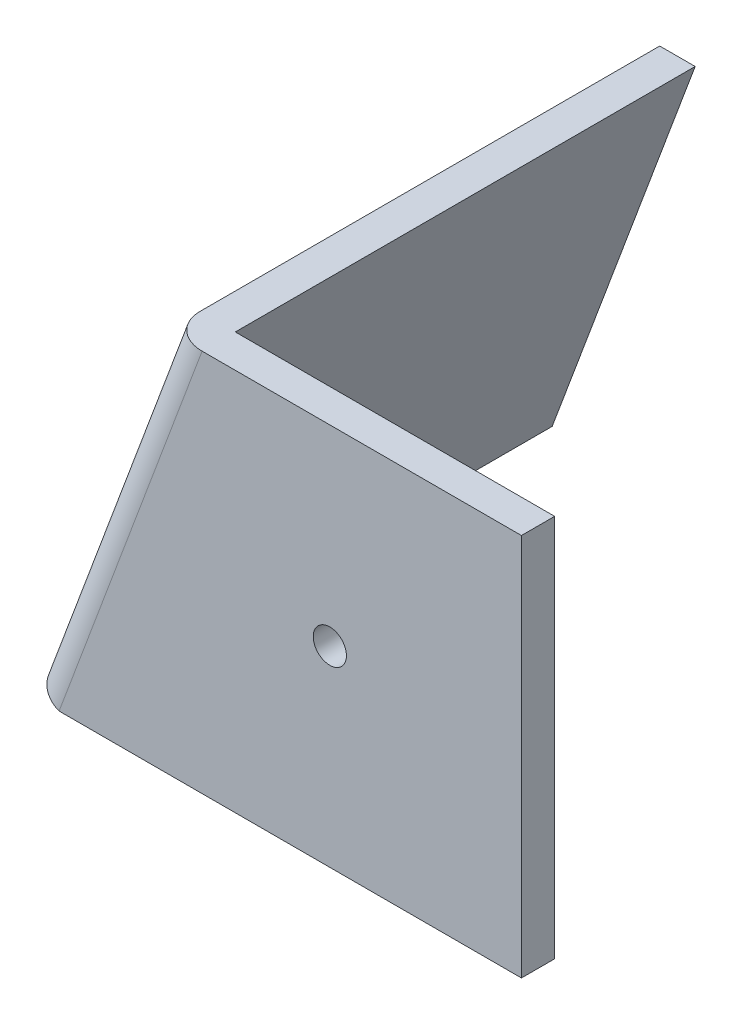
from build123d import *

# Parameters (mm, degrees)
SKETCH13_R              = 1.651
BASE_FLANGE5_DEPTH      = 3.302
EDGE_FLANGE4_START      = -51.763631849
EDGE_FLANGE4_DEPTH      = 40.665312179
CUT_EXTRUDE4_DEPTH      = 4.699
CUT_EXTRUDE4_DEPTH_BACK = 56.896


# Read off the part's stored shape, not the designer's step: Edge-Flange4
# Sheet-metal steps are written as plain solids
with BuildPart() as part:
    # Sketch13 → Base-Flange5 (new body)
    with BuildSketch(Plane.XY):
        Polygon((-31.75, 0), (0, 0), (0, -38.1), (-45.964697135, -38.1), align=None)
        with Locations((-19.05, -19.05)):
            Circle(SKETCH13_R, mode=Mode.SUBTRACT)
    extrude(amount=-BASE_FLANGE5_DEPTH)

    # Edge-Flange4 outline → Edge-Flange4 (add)
    with BuildSketch(Plane(origin=(0, 0, 0), x_dir=(0.9369164518419233, -0.34955337542060905, 0), z_dir=(0.34955337542060905, 0.9369164518419232, 0)).offset(EDGE_FLANGE4_START)):
        with BuildLine():
            ThreePointArc((-33.049097346, 3.302), (-32.081963937, 0.967133409), (-29.747097346, 0))
            Line((-29.747097346, 0), (-29.747097346, 49.022))
            Line((-29.747097346, 49.022), (-33.049097346, 49.022))
            Line((-33.049097346, 49.022), (-33.049097346, 3.302))
        make_face()
    extrude(amount=EDGE_FLANGE4_DEPTH)

    # Sketch51 → Cut-Extrude4 (cut, two sides: drawn at the far end of the back side and taken through both)
    with BuildSketch(Plane.XY.offset(-CUT_EXTRUDE4_DEPTH_BACK)):
        Polygon((-31.75, 0), (-35.274327056, 0), (-34.843698124, 1.154225246), align=None)
    extrude(amount=CUT_EXTRUDE4_DEPTH + CUT_EXTRUDE4_DEPTH_BACK, mode=Mode.SUBTRACT)


solid = part.part
